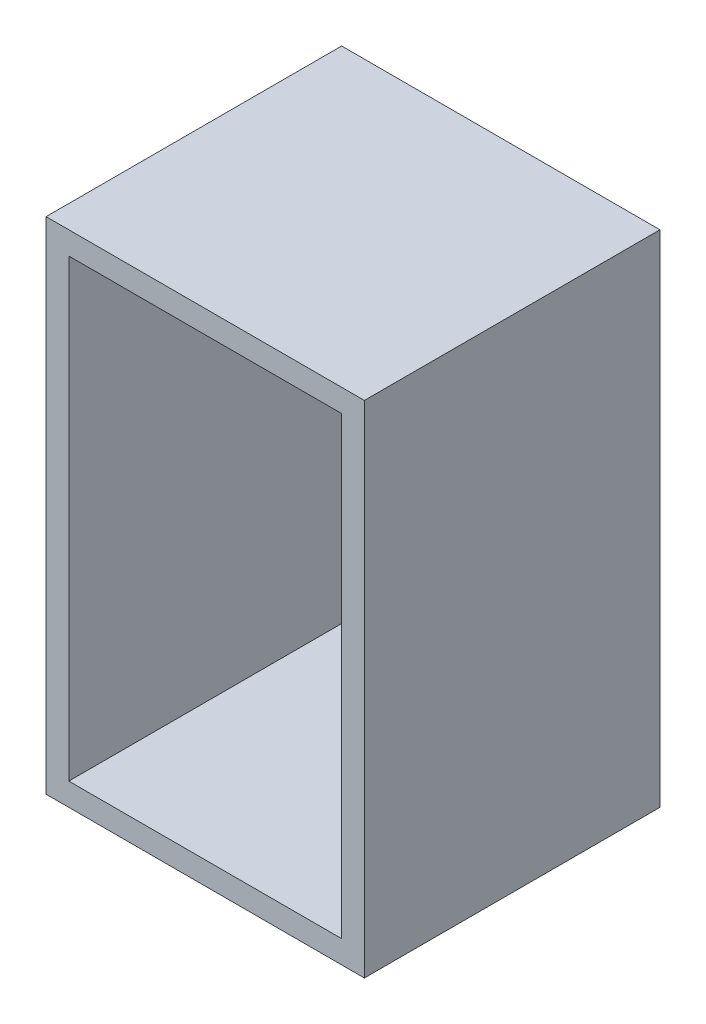
from build123d import *

# Parameters (mm, degrees)
SKETCH2_W           = 355.6
SKETCH2_H           = 558.8
BOSS_EXTRUDE1_DEPTH = 25.4
SKETCH3_W           = 355.6
SKETCH3_H           = 558.8
SKETCH3_W_2         = 304.8
SKETCH3_H_2         = 508
BOSS_EXTRUDE2_DEPTH = 304.8


with BuildPart() as part:
    # Sketch2 → Boss-Extrude1 (new body)
    with BuildSketch(Plane.XY):
        Rectangle(SKETCH2_W, SKETCH2_H)
    extrude(amount=BOSS_EXTRUDE1_DEPTH)

    # Sketch3 → Boss-Extrude2 (add)
    with BuildSketch(Plane.XY.offset(25.4)):
        Rectangle(SKETCH3_W, SKETCH3_H)
        Rectangle(SKETCH3_W_2, SKETCH3_H_2, mode=Mode.SUBTRACT)
    extrude(amount=BOSS_EXTRUDE2_DEPTH)


solid = part.part
